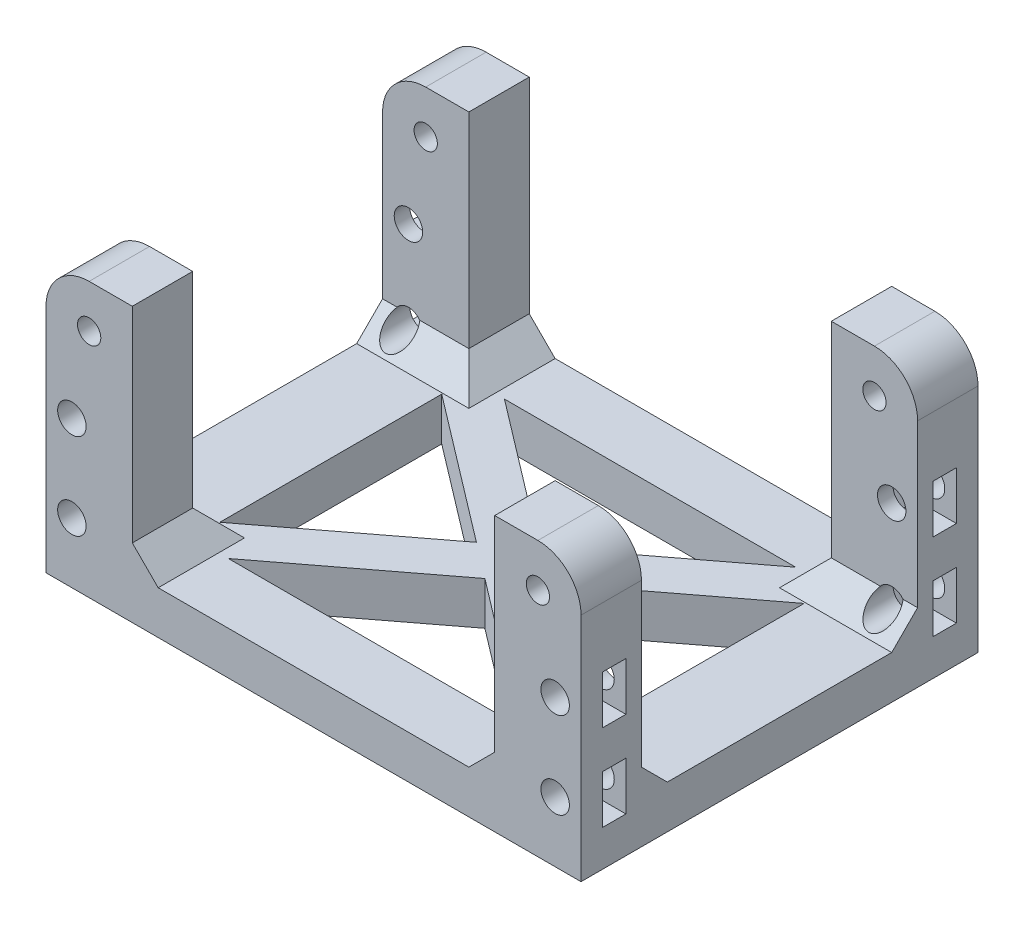
from build123d import *

# Parameters (mm, degrees)
SKETCH_1_W          = 62
SKETCH_1_H          = 46
EXTRUDE_1_DEPTH     = 5
SKETCH_2_W          = 10
SKETCH_2_H          = 17
EXTRUDE_2_DEPTH     = 7
SKETCH_3_R          = 1.65
CUT_EXTRUDE_1_DEPTH = 12
SKETCH_7_W          = 10
SKETCH_7_H          = 7
EXTRUDE_4_DEPTH     = 9.75
CUT_EXTRUDE_4_REACH = 65.914
SKETCH_8_R          = 1.35
CUT_EXTRUDE_2_DEPTH = 2.7
CUT_EXTRUDE_3_REACH = 51.981
SKETCH_5_W          = 42
SKETCH_5_H          = 32
EXTRUDE_3_DEPTH     = 5
CHAMFER_4_SIZE      = 3
FILLET_1_R          = 5


with BuildPart() as part:
    # 草图1 → 凸台-拉伸1 (new body)
    with BuildSketch(Plane(origin=(0, 0, 0), x_dir=(1, 0, 0), z_dir=(0, 1, 0))):
        Rectangle(SKETCH_1_W, SKETCH_1_H)
    extrude(amount=EXTRUDE_1_DEPTH)

    # 草图2 → 凸台-拉伸2 (add)
    with BuildSketch(Plane.XY.offset(23)):
        with Locations((-26, 13.5)):
            Rectangle(SKETCH_2_W, SKETCH_2_H)
        with Locations((26, 13.5)):
            Rectangle(SKETCH_2_W, SKETCH_2_H)
    extrude_2 = extrude(amount=-EXTRUDE_2_DEPTH)

    # 草图3 → 切除-拉伸1 (cut)
    with BuildSketch(Plane.XY.offset(23)):
        with Locations((-28, 17)):
            Circle(SKETCH_3_R)
        with Locations((-28, 7)):
            Circle(SKETCH_3_R)
        with Locations((28, 7)):
            Circle(SKETCH_3_R)
        with Locations((28, 17)):
            Circle(SKETCH_3_R)
    cut_extrude_1 = extrude(amount=-CUT_EXTRUDE_1_DEPTH, mode=Mode.SUBTRACT)

    # 草图7 → 凸台-拉伸4 (add)
    with BuildSketch(Plane(origin=(0, 22, 0), x_dir=(1, 0, 0), z_dir=(0, 1, 0))):
        with Locations((-26, -19.5)):
            Rectangle(SKETCH_7_W, SKETCH_7_H)
        with Locations((26, -19.5)):
            Rectangle(SKETCH_7_W, SKETCH_7_H)
    extrude_4 = extrude(amount=EXTRUDE_4_DEPTH)

    # 草图8 → 切除-拉伸4 (cut, up to next)
    with BuildSketch(Plane.XY.offset(23), mode=Mode.PRIVATE) as cut_extrude_4_sk1:
        with Locations((-26, 26.75)):
            Circle(SKETCH_8_R)
    cut_extrude_4_tool1 = extrude(cut_extrude_4_sk1.sketch, amount=-CUT_EXTRUDE_4_REACH, mode=Mode.PRIVATE) & part.part
    # 草图8 → 切除-拉伸4 (cut, up to next)
    with BuildSketch(Plane.XY.offset(23), mode=Mode.PRIVATE) as cut_extrude_4_sk2:
        with Locations((26, 26.75)):
            Circle(SKETCH_8_R)
    cut_extrude_4_tool2 = extrude(cut_extrude_4_sk2.sketch, amount=-CUT_EXTRUDE_4_REACH, mode=Mode.PRIVATE) & part.part
    cut_extrude_4_1 = cut_extrude_4_tool1.solids().sort_by_distance((-26, 26.75, 23))[0]
    add(cut_extrude_4_1, mode=Mode.SUBTRACT)
    cut_extrude_4_2 = cut_extrude_4_tool2.solids().sort_by_distance((26, 26.75, 23))[0]
    add(cut_extrude_4_2, mode=Mode.SUBTRACT)
    cut_extrude_4 = cut_extrude_4_1 + cut_extrude_4_2  # 切除-拉伸4 as one shape, for the pattern or mirror that repeats it

    # 草图4 → 切除-拉伸2 (cut)
    with BuildSketch(Plane.XY.offset(20.5)):
        Polygon((-29.616580754, 19.8), (-31.233161507, 19.8), (-31.233161507, 17), (-31.233161507, 14.2), (-29.616580754, 14.2), (-26.383419246, 14.2), (-24.766838493, 17), (-26.383419246, 19.8), align=None)
        Polygon((-24.766838493, 7), (-26.383419246, 9.8), (-29.616580754, 9.8), (-31.233161507, 9.8), (-31.233161507, 7), (-31.233161507, 4.2), (-29.616580754, 4.2), (-26.383419246, 4.2), align=None)
        Polygon((24.766838493, 17), (26.383419246, 14.2), (29.616580754, 14.2), (31.233161507, 14.2), (31.233161507, 17), (31.233161507, 19.8), (29.616580754, 19.8), (26.383419246, 19.8), align=None)
        Polygon((24.766838493, 7), (26.383419246, 4.2), (29.616580754, 4.2), (31.233161507, 4.2), (31.233161507, 7), (31.233161507, 9.8), (29.616580754, 9.8), (26.383419246, 9.8), align=None)
    cut_extrude_2 = extrude(amount=-CUT_EXTRUDE_2_DEPTH, mode=Mode.SUBTRACT)

    # 镜向1: 凸台-拉伸2, 切除-拉伸1, 凸台-拉伸4, 切除-拉伸4, 切除-拉伸2 across plane
    add(extrude_2.mirror(Plane.XY))
    add(cut_extrude_1.mirror(Plane.XY), mode=Mode.SUBTRACT)
    add(extrude_4.mirror(Plane.XY))
    add(cut_extrude_4.mirror(Plane.XY), mode=Mode.SUBTRACT)
    add(cut_extrude_2.mirror(Plane.XY), mode=Mode.SUBTRACT)

    # 草图5 → 切除-拉伸3 (cut, up to next)
    with BuildSketch(Plane(origin=(0, 31.75, 0), x_dir=(1, 0, 0), z_dir=(0, 1, 0)), mode=Mode.PRIVATE) as cut_extrude_3_sk1:
        Rectangle(SKETCH_5_W, SKETCH_5_H)
    cut_extrude_3_tool1 = extrude(cut_extrude_3_sk1.sketch, amount=-CUT_EXTRUDE_3_REACH, mode=Mode.PRIVATE) & part.part
    add(cut_extrude_3_tool1.solids().sort_by_distance((0, 31.75, 0))[0], mode=Mode.SUBTRACT)

    # 草图6 → 凸台-拉伸3 (add)
    with BuildSketch(Plane(origin=(0, 0, 0), x_dir=(1, 0, 0), z_dir=(0, 1, 0))):
        Polygon((-22.515108038, 14.0114207), (-4.12511837, 0), (0, 3.142947329), (-19.484891962, 17.9885793), align=None)
        Polygon((0, 3.142947329), (4.12511837, 0), (22.515108038, 14.0114207), (19.484891962, 17.9885793), align=None)
        Polygon((-4.12511837, 0), (0, -3.142947329), (4.12511837, 0), (0, 3.142947329), align=None)
        Polygon((-19.484891962, -17.9885793), (0, -3.142947329), (-4.12511837, 0), (-22.515108038, -14.0114207), align=None)
        Polygon((0, -3.142947329), (19.484891962, -17.9885793), (22.515108038, -14.0114207), (4.12511837, 0), align=None)
    extrude(amount=EXTRUDE_3_DEPTH)

    # 倒角4
    # the kernel refuses this chamfer: 3 mm, written as the material it adds along each edge
    with BuildSketch(Plane(origin=(-31, 5, 16), x_dir=(0, -0.027495876610586494, -0.9996219169112968), z_dir=(1, 0, 0))) as chamfer_4_piece_1_section:
        Polygon((CHAMFER_4_SIZE * 0.999621916911, CHAMFER_4_SIZE * 0.0274958766106), (-CHAMFER_4_SIZE * 0.0274958766106, CHAMFER_4_SIZE * 0.999621916911), (0, 0), align=None)
    chamfer_4_piece_1 = extrude(amount=10, mode=Mode.PRIVATE)
    chamfer_4_piece_1 = chamfer_4_piece_1 - Plane(origin=(-28, 7, 14.954388988), x_dir=(1, 0, 0), z_dir=(0, 0, 1)) * Cylinder(1.65, 32, mode=Mode.PRIVATE)
    add(chamfer_4_piece_1)
    with BuildSketch(Plane(origin=(-21, 5, 23), x_dir=(-0.02749587661058678, 0.9996219169112968, 0), z_dir=(0, 0, -1)), Plane(origin=(-21, 5, -23), x_dir=(0.9996219169112968, -0.02749587661058648, 0), z_dir=(0, 0, 1)), Plane(origin=(21, 5, 23), x_dir=(-0.9996219169112968, -0.02749587661058619, 0), z_dir=(0, 0, -1))) as chamfer_4_piece_2:
        Polygon((CHAMFER_4_SIZE * 0.999621916911, CHAMFER_4_SIZE * 0.0274958766106), (-CHAMFER_4_SIZE * 0.0274958766106, CHAMFER_4_SIZE * 0.999621916911), (0, 0), align=None)
    extrude(amount=7)
    with BuildSketch(Plane(origin=(-31, 5, -16), x_dir=(0, -0.027495876610586494, 0.9996219169112968), z_dir=(1, 0, 0))) as chamfer_4_piece_3_section:
        Polygon((CHAMFER_4_SIZE * 0.999621916911, -CHAMFER_4_SIZE * 0.0274958766106), (-CHAMFER_4_SIZE * 0.0274958766106, -CHAMFER_4_SIZE * 0.999621916911), (0, 0), align=None)
    chamfer_4_piece_3 = extrude(amount=10, mode=Mode.PRIVATE)
    chamfer_4_piece_3 = chamfer_4_piece_3 - Plane(origin=(-28, 7, -14.954388988), x_dir=(1, 0, 0), z_dir=(0, 0, -1)) * Cylinder(1.65, 32, mode=Mode.PRIVATE)
    add(chamfer_4_piece_3)
    with BuildSketch(Plane(origin=(21, 5, -23), x_dir=(-0.9996219169112968, -0.02749587661058619, 0), z_dir=(0, 0, 1))) as chamfer_4_piece_4:
        Polygon((CHAMFER_4_SIZE * 0.999621916911, -CHAMFER_4_SIZE * 0.0274958766106), (-CHAMFER_4_SIZE * 0.0274958766106, -CHAMFER_4_SIZE * 0.999621916911), (0, 0), align=None)
    extrude(amount=7)
    with BuildSketch(Plane(origin=(31, 5, -16), x_dir=(0, -0.027495876610586494, 0.9996219169112968), z_dir=(-1, 0, 0))) as chamfer_4_piece_5_section:
        Polygon((CHAMFER_4_SIZE * 0.999621916911, CHAMFER_4_SIZE * 0.0274958766106), (-CHAMFER_4_SIZE * 0.0274958766106, CHAMFER_4_SIZE * 0.999621916911), (0, 0), align=None)
    chamfer_4_piece_5 = extrude(amount=10, mode=Mode.PRIVATE)
    chamfer_4_piece_5 = chamfer_4_piece_5 - Plane(origin=(28, 7, -14.954389008), x_dir=(1, 0, 0), z_dir=(0, 0, -1)) * Cylinder(1.65, 32, mode=Mode.PRIVATE)
    add(chamfer_4_piece_5)
    with BuildSketch(Plane(origin=(31, 5, 16), x_dir=(0, -0.027495876610586494, -0.9996219169112968), z_dir=(-1, 0, 0))) as chamfer_4_piece_6_section:
        Polygon((CHAMFER_4_SIZE * 0.999621916911, -CHAMFER_4_SIZE * 0.0274958766106), (-CHAMFER_4_SIZE * 0.0274958766106, -CHAMFER_4_SIZE * 0.999621916911), (0, 0), align=None)
    chamfer_4_piece_6 = extrude(amount=10, mode=Mode.PRIVATE)
    chamfer_4_piece_6 = chamfer_4_piece_6 - Plane(origin=(28, 7, 14.954389008), x_dir=(1, 0, 0), z_dir=(0, 0, 1)) * Cylinder(1.65, 32, mode=Mode.PRIVATE)
    add(chamfer_4_piece_6)
    with BuildSketch(Plane(origin=(-21, 5, 23), x_dir=(-0.02749587661058678, 0.9996219169112968, 0), z_dir=(0, 0, -1))) as chamfer_4_piece_7a_section:
        Polygon((CHAMFER_4_SIZE * 0.999621916911, CHAMFER_4_SIZE * 0.0274958766106), (-CHAMFER_4_SIZE * 0.0274958766106, CHAMFER_4_SIZE * 0.999621916911), (0, 0), align=None)
    chamfer_4_piece_7a = extrude(amount=14.715048964, mode=Mode.PRIVATE)
    chamfer_4_piece_7a = split(chamfer_4_piece_7a, bisect_by=Plane(origin=(-19.8988735, 5.929641192, 16), z_dir=(0, 0, -1)), keep=Keep.TOP, mode=Mode.PRIVATE)
    chamfer_4_piece_7a = split(chamfer_4_piece_7a, bisect_by=Plane(origin=(-20.858643002, 5.929641192, 12.749352101), z_dir=(0.6060432152628566, 0, 0.7954317200324984)), keep=Keep.TOP, mode=Mode.PRIVATE)
    with BuildSketch(Plane(origin=(-31, 5, 16), x_dir=(0, -0.027495876610586494, -0.9996219169112968), z_dir=(1, 0, 0))) as chamfer_4_piece_7b_section:
        Polygon((CHAMFER_4_SIZE * 0.999621916911, CHAMFER_4_SIZE * 0.0274958766106), (-CHAMFER_4_SIZE * 0.0274958766106, CHAMFER_4_SIZE * 0.999621916911), (0, 0), align=None)
    chamfer_4_piece_7b = extrude(amount=17.715048964, mode=Mode.PRIVATE)
    chamfer_4_piece_7b = split(chamfer_4_piece_7b, bisect_by=Plane(origin=(-21, 5.915915897, 14.873215442), z_dir=(1, 0, 0)), keep=Keep.TOP, mode=Mode.PRIVATE)
    chamfer_4_piece_7b = split(chamfer_4_piece_7b, bisect_by=Plane(origin=(-17.170062576, 5.915915897, 16.224899768), z_dir=(-0.6060432152628568, 0, -0.7954317200324983)), keep=Keep.TOP, mode=Mode.PRIVATE)
    chamfer_4_piece_7 = chamfer_4_piece_7a & chamfer_4_piece_7b
    add(chamfer_4_piece_7)
    with BuildSketch(Plane(origin=(-21, 5, -23), x_dir=(0.9996219169112968, -0.02749587661058648, 0), z_dir=(0, 0, 1))) as chamfer_4_piece_8a_section:
        Polygon((CHAMFER_4_SIZE * 0.999621916911, CHAMFER_4_SIZE * 0.0274958766106), (-CHAMFER_4_SIZE * 0.0274958766106, CHAMFER_4_SIZE * 0.999621916911), (0, 0), align=None)
    chamfer_4_piece_8a = extrude(amount=14.715048964, mode=Mode.PRIVATE)
    chamfer_4_piece_8a = split(chamfer_4_piece_8a, bisect_by=Plane(origin=(-20.858643002, 5.929641192, -12.749352101), z_dir=(0.6060432152628563, 0, -0.7954317200324986)), keep=Keep.TOP, mode=Mode.PRIVATE)
    chamfer_4_piece_8a = split(chamfer_4_piece_8a, bisect_by=Plane(origin=(-19.8988735, 5.929641192, -16), z_dir=(0, 0, 1)), keep=Keep.TOP, mode=Mode.PRIVATE)
    with BuildSketch(Plane(origin=(-31, 5, -16), x_dir=(0, -0.027495876610586494, 0.9996219169112968), z_dir=(1, 0, 0))) as chamfer_4_piece_8b_section:
        Polygon((CHAMFER_4_SIZE * 0.999621916911, -CHAMFER_4_SIZE * 0.0274958766106), (-CHAMFER_4_SIZE * 0.0274958766106, -CHAMFER_4_SIZE * 0.999621916911), (0, 0), align=None)
    chamfer_4_piece_8b = extrude(amount=17.715048964, mode=Mode.PRIVATE)
    chamfer_4_piece_8b = split(chamfer_4_piece_8b, bisect_by=Plane(origin=(-17.170062576, 5.915915897, -16.224899768), z_dir=(-0.6060432152628565, 0, 0.7954317200324984)), keep=Keep.TOP, mode=Mode.PRIVATE)
    chamfer_4_piece_8b = split(chamfer_4_piece_8b, bisect_by=Plane(origin=(-21, 5.915915897, -14.873215442), z_dir=(1, 0, 0)), keep=Keep.TOP, mode=Mode.PRIVATE)
    chamfer_4_piece_8 = chamfer_4_piece_8a & chamfer_4_piece_8b
    add(chamfer_4_piece_8)
    with BuildSketch(Plane(origin=(31, 5, -16), x_dir=(0, -0.027495876610586494, 0.9996219169112968), z_dir=(-1, 0, 0))) as chamfer_4_piece_9a_section:
        Polygon((CHAMFER_4_SIZE * 0.999621916911, CHAMFER_4_SIZE * 0.0274958766106), (-CHAMFER_4_SIZE * 0.0274958766106, CHAMFER_4_SIZE * 0.999621916911), (0, 0), align=None)
    chamfer_4_piece_9a = extrude(amount=17.715048964, mode=Mode.PRIVATE)
    chamfer_4_piece_9a = split(chamfer_4_piece_9a, bisect_by=Plane(origin=(17.170062576, 5.915915897, -16.224899768), z_dir=(0.6060432152628568, 0, 0.7954317200324984)), keep=Keep.TOP, mode=Mode.PRIVATE)
    chamfer_4_piece_9a = split(chamfer_4_piece_9a, bisect_by=Plane(origin=(21, 5.915915897, -14.873215442), z_dir=(-1, 0, 0)), keep=Keep.TOP, mode=Mode.PRIVATE)
    with BuildSketch(Plane(origin=(21, 5, -23), x_dir=(-0.9996219169112968, -0.02749587661058619, 0), z_dir=(0, 0, 1))) as chamfer_4_piece_9b_section:
        Polygon((CHAMFER_4_SIZE * 0.999621916911, -CHAMFER_4_SIZE * 0.0274958766106), (-CHAMFER_4_SIZE * 0.0274958766106, -CHAMFER_4_SIZE * 0.999621916911), (0, 0), align=None)
    chamfer_4_piece_9b = extrude(amount=14.715048964, mode=Mode.PRIVATE)
    chamfer_4_piece_9b = split(chamfer_4_piece_9b, bisect_by=Plane(origin=(20.858643002, 5.929641192, -12.749352101), z_dir=(-0.6060432152628568, 0, -0.7954317200324983)), keep=Keep.TOP, mode=Mode.PRIVATE)
    chamfer_4_piece_9b = split(chamfer_4_piece_9b, bisect_by=Plane(origin=(19.8988735, 5.929641192, -16), z_dir=(0, 0, 1)), keep=Keep.TOP, mode=Mode.PRIVATE)
    chamfer_4_piece_9 = chamfer_4_piece_9a & chamfer_4_piece_9b
    add(chamfer_4_piece_9)
    with BuildSketch(Plane(origin=(21, 5, 23), x_dir=(-0.9996219169112968, -0.02749587661058619, 0), z_dir=(0, 0, -1))) as chamfer_4_piece_10a_section:
        Polygon((CHAMFER_4_SIZE * 0.999621916911, CHAMFER_4_SIZE * 0.0274958766106), (-CHAMFER_4_SIZE * 0.0274958766106, CHAMFER_4_SIZE * 0.999621916911), (0, 0), align=None)
    chamfer_4_piece_10a = extrude(amount=14.715048964, mode=Mode.PRIVATE)
    chamfer_4_piece_10a = split(chamfer_4_piece_10a, bisect_by=Plane(origin=(20.858643002, 5.929641192, 12.749352101), z_dir=(-0.6060432152628565, 0, 0.7954317200324984)), keep=Keep.TOP, mode=Mode.PRIVATE)
    chamfer_4_piece_10a = split(chamfer_4_piece_10a, bisect_by=Plane(origin=(19.8988735, 5.929641192, 16), z_dir=(0, 0, -1)), keep=Keep.TOP, mode=Mode.PRIVATE)
    with BuildSketch(Plane(origin=(31, 5, 16), x_dir=(0, -0.027495876610586494, -0.9996219169112968), z_dir=(-1, 0, 0))) as chamfer_4_piece_10b_section:
        Polygon((CHAMFER_4_SIZE * 0.999621916911, -CHAMFER_4_SIZE * 0.0274958766106), (-CHAMFER_4_SIZE * 0.0274958766106, -CHAMFER_4_SIZE * 0.999621916911), (0, 0), align=None)
    chamfer_4_piece_10b = extrude(amount=17.715048964, mode=Mode.PRIVATE)
    chamfer_4_piece_10b = split(chamfer_4_piece_10b, bisect_by=Plane(origin=(17.170062576, 5.915915897, 16.224899768), z_dir=(0.6060432152628563, 0, -0.7954317200324986)), keep=Keep.TOP, mode=Mode.PRIVATE)
    chamfer_4_piece_10b = split(chamfer_4_piece_10b, bisect_by=Plane(origin=(21, 5.915915897, 14.873215442), z_dir=(-1, 0, 0)), keep=Keep.TOP, mode=Mode.PRIVATE)
    chamfer_4_piece_10 = chamfer_4_piece_10a & chamfer_4_piece_10b
    add(chamfer_4_piece_10)

    # 圆角1
    fillet_1_edges = [part.edges().sort_by_distance(p)[0] for p in [
        (-31, 31.75, -19.5),
        (31, 31.75, -19.5),
        (-31, 31.75, 19.5),
        (31, 31.75, 19.5),
    ]]
    fillet(fillet_1_edges, radius=FILLET_1_R)


solid = part.part
